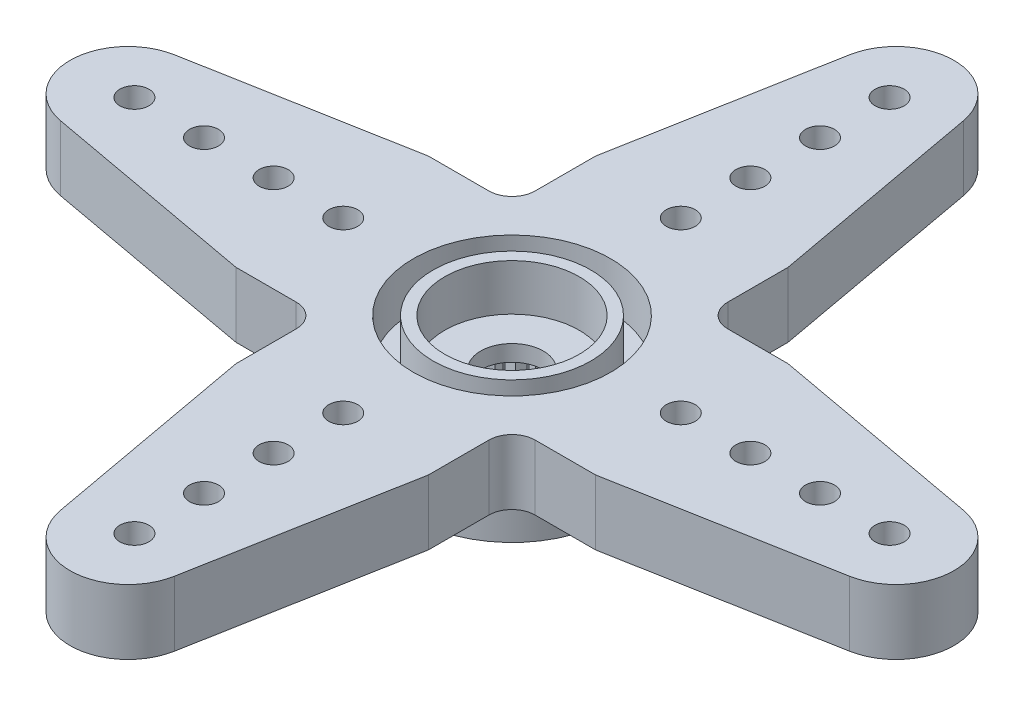
from build123d import *

# Parameters (mm, degrees)
SKETCH1_R                            = 4.35
REBAIXO_DE_ENCAIXE_DEPTH             = 2.6
SKETCH14_R                           = 2.45
FURO_DE_ENCAIXE_SERVO_DEPTH          = 3
SKETCH25_R                           = 1.35
BASE_4_BRA_OS_DEPTH                  = 2.8
SKETCH26_R                           = 0.625
FUROS_DE_FIXA_O_CARGA_4_BRA_OS_DEPTH = 28.47662643
REBAIXO_START                        = -2
SKETCH27_R                           = 4.25
SKETCH27_R_2                         = 3.4
SKETCH27_R_3                         = 2.9
SKETCH27_R_4                         = 1.35
REBAIXO_CENTRAL_4_BRA_OS_DEPTH       = 2
CUT_EXTRUDE3_DEPTH                   = 2.7


with BuildPart() as part:
    # Sketch1 → Rebaixo de Encaixe (new body)
    with BuildSketch(Plane(origin=(0, 0, 0), x_dir=(1, 0, 0), z_dir=(0, 1, 0))):
        Circle(SKETCH1_R)
    extrude(amount=REBAIXO_DE_ENCAIXE_DEPTH)

    # Sketch14 → Furo de Encaixe - Servo (cut)
    with BuildSketch(Plane.XZ):
        Circle(SKETCH14_R)
    extrude(amount=-FURO_DE_ENCAIXE_SERVO_DEPTH, mode=Mode.SUBTRACT)

    # Sketch25 → Base 4 Braços (add)
    with BuildSketch(Plane(origin=(0, 2.6, 0), x_dir=(1, 0, 0), z_dir=(0, 1, 0))):
        with BuildLine():
            Line((5.15, 4.15), (7.75, 4.15))
            Line((7.75, 4.15), (16.999533537, 2.459251837))
            ThreePointArc((16.999533537, 2.459251837), (19.05, 0), (16.999533537, -2.459251837))
            Line((16.999533537, -2.459251837), (7.75, -4.15))
            Line((7.75, -4.15), (5.15, -4.15))
            ThreePointArc((5.15, -4.15), (4.442893219, -4.442893219), (4.15, -5.15))
            Line((4.15, -5.15), (4.15, -7.75))
            Line((4.15, -7.75), (2.459251837, -16.999533537))
            ThreePointArc((2.459251837, -16.999533537), (0, -19.05), (-2.459251837, -16.999533537))
            Line((-2.459251837, -16.999533537), (-4.15, -7.75))
            Line((-4.15, -7.75), (-4.15, -5.15))
            ThreePointArc((-4.15, -5.15), (-4.442893219, -4.442893219), (-5.15, -4.15))
            Line((-5.15, -4.15), (-7.75, -4.15))
            Line((-7.75, -4.15), (-16.999533537, -2.459251837))
            ThreePointArc((-16.999533537, -2.459251837), (-19.05, 0), (-16.999533537, 2.459251837))
            Line((-16.999533537, 2.459251837), (-7.75, 4.15))
            Line((-7.75, 4.15), (-5.15, 4.15))
            ThreePointArc((-5.15, 4.15), (-4.442893219, 4.442893219), (-4.15, 5.15))
            Line((-4.15, 5.15), (-4.15, 7.75))
            Line((-4.15, 7.75), (-2.459251837, 16.999533537))
            ThreePointArc((-2.459251837, 16.999533537), (0, 19.05), (2.459251837, 16.999533537))
            Line((2.459251837, 16.999533537), (4.15, 7.75))
            Line((4.15, 7.75), (4.15, 5.15))
            ThreePointArc((4.15, 5.15), (4.442893219, 4.442893219), (5.15, 4.15))
        make_face()
        Circle(SKETCH25_R, mode=Mode.SUBTRACT)
    extrude(amount=BASE_4_BRA_OS_DEPTH)

    # Sketch26 → Furos de Fixação - Carga 4 Braços (cut, through all)
    with BuildSketch(Plane(origin=(0, 5.4, 0), x_dir=(1, 0, 0), z_dir=(0, 1, 0))):
        with Locations((16.275, 0)):
            Circle(SKETCH26_R)
        with Locations((13.275, 0)):
            Circle(SKETCH26_R)
        with Locations((10.275, 0)):
            Circle(SKETCH26_R)
        with Locations((7.275, 0)):
            Circle(SKETCH26_R)
        with Locations((0, -16.275)):
            Circle(SKETCH26_R)
        with Locations((0, -13.275)):
            Circle(SKETCH26_R)
        with Locations((0, -10.275)):
            Circle(SKETCH26_R)
        with Locations((0, -7.275)):
            Circle(SKETCH26_R)
        with Locations((-16.275, 0)):
            Circle(SKETCH26_R)
        with Locations((-13.275, 0)):
            Circle(SKETCH26_R)
        with Locations((-10.275, 0)):
            Circle(SKETCH26_R)
        with Locations((-7.275, 0)):
            Circle(SKETCH26_R)
        with Locations((0, 16.275)):
            Circle(SKETCH26_R)
        with Locations((0, 13.275)):
            Circle(SKETCH26_R)
        with Locations((0, 10.275)):
            Circle(SKETCH26_R)
        with Locations((0, 7.275)):
            Circle(SKETCH26_R)
    extrude(amount=-FUROS_DE_FIXA_O_CARGA_4_BRA_OS_DEPTH, mode=Mode.SUBTRACT)

    # Sketch27 → Rebaixo Central - 4 Braços (cut)
    # profile 1 of 2: a face of its own
    with BuildSketch(Plane(origin=(0, 5.4, 0), x_dir=(1, 0, 0), z_dir=(0, 1, 0)).offset(REBAIXO_START)):
        Circle(SKETCH27_R)
        Circle(SKETCH27_R_2, mode=Mode.SUBTRACT)
    # profile 2 of 2: a face of its own
    with BuildSketch(Plane(origin=(0, 5.4, 0), x_dir=(1, 0, 0), z_dir=(0, 1, 0)).offset(REBAIXO_START)):
        Circle(SKETCH27_R_3)
        Circle(SKETCH27_R_4, mode=Mode.SUBTRACT)
    extrude(amount=REBAIXO_CENTRAL_4_BRA_OS_DEPTH, mode=Mode.SUBTRACT)

    # Sketch31 → Cut-Extrude3 (cut)
    with BuildSketch(Plane.XZ):
        with BuildLine():
            Line((-1.693127351, -1.839380269), (-1.717389842, -2.367740934))
            ThreePointArc((-1.717389842, -2.367740934), (-1.695612039, -2.383385158), (-1.673691738, -2.398829083))
            Line((-1.673691738, -2.398829083), (-1.18249937, -2.202656405))
            Line((-1.18249937, -2.202656405), (-1.074601656, -2.720451485))
            ThreePointArc((-1.074601656, -2.720451485), (-1.049617483, -2.730188297), (-1.0245451, -2.739695665))
            Line((-1.0245451, -2.739695665), (-0.597570605, -2.427531539))
            Line((-0.597570605, -2.427531539), (-0.364292296, -2.902226063))
            ThreePointArc((-0.364292296, -2.902226063), (-0.3376716, -2.905443665), (-0.311022526, -2.908417093))
            Line((-0.311022526, -2.908417093), (0.024905719, -2.499875938))
            Line((0.024905719, -2.499875938), (0.368906888, -2.901643105))
            ThreePointArc((0.368906888, -2.901643105), (0.395491431, -2.898139322), (0.422042737, -2.894391979))
            Line((0.422042737, -2.894391979), (0.645817125, -2.415143938))
            Line((0.645817125, -2.415143938), (1.078926296, -2.718739239))
            ThreePointArc((1.078926296, -2.718739239), (1.103804282, -2.708734226), (1.128589503, -2.698501572))
            Line((1.128589503, -2.698501572), (1.226149466, -2.178659562))
            Line((1.226149466, -2.178659562), (1.721152797, -2.365006987))
            ThreePointArc((1.721152797, -2.365006987), (1.742761049, -2.349129397), (1.76422284, -2.333054386))
            Line((1.76422284, -2.333054386), (1.729438326, -1.805281994))
            Line((1.729438326, -1.805281994), (2.255232938, -1.862672649))
            ThreePointArc((2.255232938, -1.862672649), (2.272213731, -1.841920129), (2.289003568, -1.821012814))
            Line((2.289003568, -1.821012814), (2.124060216, -1.318471918))
            Line((2.124060216, -1.318471918), (2.647608499, -1.243299737))
            ThreePointArc((2.647608499, -1.243299737), (2.658894867, -1.218976244), (2.669957782, -1.194550309))
            Line((2.669957782, -1.194550309), (2.385219591, -0.748817403))
            Line((2.385219591, -0.748817403), (2.873625081, -0.545805731))
            ThreePointArc((2.873625081, -0.545805731), (2.87850786, -0.5194396), (2.88314873, -0.493029814))
            Line((2.88314873, -0.493029814), (2.496506847, -0.132111936))
            Line((2.496506847, -0.132111936), (2.91908123, 0.185983257))
            ThreePointArc((2.91908123, 0.185983257), (2.917253618, 0.212735346), (2.91518084, 0.239469556))
            Line((2.91518084, 0.239469556), (2.450929396, 0.492894609))
            Line((2.450929396, 0.492894609), (2.78112077, 0.906086233))
            ThreePointArc((2.78112077, 0.906086233), (2.772697602, 0.931543347), (2.764041417, 0.956922174))
            Line((2.764041417, 0.956922174), (2.251351037, 1.086930774))
            Line((2.251351037, 1.086930774), (2.468412264, 1.569256478))
            ThreePointArc((2.468412264, 1.569256478), (2.453922799, 1.591819053), (2.439227105, 1.614247852))
            Line((2.439227105, 1.614247852), (1.910312013, 1.61267108))
            Line((1.910312013, 1.61267108), (2.000604337, 2.133824567))
            ThreePointArc((2.000604337, 2.133824567), (1.980959001, 2.152074915), (1.961147184, 2.170144401))
            Line((1.961147184, 2.170144401), (1.449241059, 2.037081332))
            Line((1.449241059, 2.037081332), (1.407091082, 2.564316612))
            ThreePointArc((1.407091082, 2.564316612), (1.383524263, 2.577107994), (1.359841173, 2.589682796))
            Line((1.359841173, 2.589682796), (0.89710896, 2.333494271))
            Line((0.89710896, 2.333494271), (0.72516512, 2.833683213))
            ThreePointArc((0.72516512, 2.833683213), (0.699157608, 2.8402119), (0.673091339, 2.846501897))
            Line((0.673091339, 2.846501897), (0.288608205, 2.483285184))
            Line((0.288608205, 2.483285184), (-0.002325634, 2.924999075))
            ThreePointArc((-0.002325634, 2.924999075), (-0.029139691, 2.924854847), (-0.055951298, 2.924464815))
            Line((-0.055951298, 2.924464815), (-0.338026864, 2.477042155))
            Line((-0.338026864, 2.477042155), (-0.72967026, 2.832526489))
            ThreePointArc((-0.72967026, 2.832526489), (-0.755606036, 2.825718408), (-0.78147831, 2.818672853))
            Line((-0.78147831, 2.818672853), (-0.943422463, 2.315157458))
            Line((-0.943422463, 2.315157458), (-1.41116702, 2.562075846))
            ThreePointArc((-1.41116702, 2.562075846), (-1.434594875, 2.549031688), (-1.457902166, 2.535773309))
            Line((-1.457902166, 2.535773309), (-1.489539359, 2.007802904))
            Line((-1.489539359, 2.007802904), (-2.003994966, 2.130640555))
            ThreePointArc((-2.003994966, 2.130640555), (-2.023442841, 2.112179933), (-2.042720666, 2.093541802))
            Line((-2.042720666, 2.093541802), (-1.942063018, 1.574290708))
            Line((-1.942063018, 1.574290708), (-2.470904539, 1.565329282))
            ThreePointArc((-2.470904539, 1.565329282), (-2.485150453, 1.542612144), (-2.499187515, 1.519765365))
            Line((-2.499187515, 1.519765365), (-2.272559716, 1.041860038))
            Line((-2.272559716, 1.041860038), (-2.782558091, 0.901662613))
            ThreePointArc((-2.782558091, 0.901662613), (-2.790706922, 0.876116361), (-2.798621221, 0.85049648))
            Line((-2.798621221, 0.85049648), (-2.460263129, 0.44396547))
            Line((-2.460263129, 0.44396547), (-2.919373286, 0.181341166))
            ThreePointArc((-2.919373286, 0.181341166), (-2.920913011, 0.154570965), (-2.922207262, 0.127787774))
            Line((-2.922207262, 0.127787774), (-2.493379161, -0.181825082))
            Line((-2.493379161, -0.181825082), (-2.87275352, -0.550374613))
            ThreePointArc((-2.87275352, -0.550374613), (-2.867587393, -0.576686693), (-2.862180275, -0.602950309))
            Line((-2.862180275, -0.602950309), (-2.36982701, -0.796190895))
            Line((-2.36982701, -0.796190895), (-2.645628085, -1.247508331))
            ThreePointArc((-2.645628085, -1.247508331), (-2.634080714, -1.271709005), (-2.622311974, -1.295802805))
            Line((-2.622311974, -1.295802805), (-2.097369913, -1.360529105))
            Line((-2.097369913, -1.360529105), (-2.252268108, -1.866256513))
            ThreePointArc((-2.252268108, -1.866256513), (-2.235065055, -1.886825164), (-2.217674168, -1.907235246))
            Line((-2.217674168, -1.907235246), (-1.693127351, -1.839380269))
        make_face()
    extrude(amount=-CUT_EXTRUDE3_DEPTH, mode=Mode.SUBTRACT)


solid = part.part
